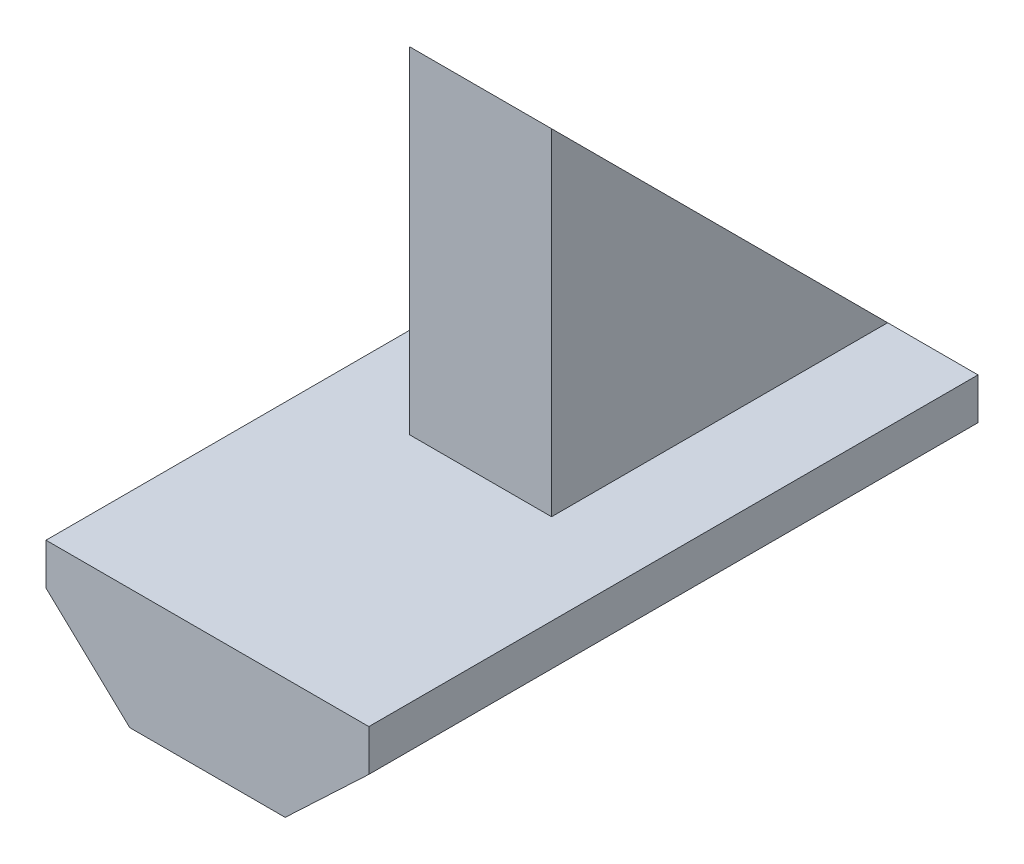
from build123d import *

# Parameters (mm, degrees)
BOSS_EXTRUDE1_DEPTH = 30
BOSS_EXTRUDE2_DEPTH = 3.5


with BuildPart() as part:
    # Sketch1 → Boss-Extrude1 (new body)
    with BuildSketch(Plane.XY):
        Polygon((7.95, 0), (7.95, -2.04), (3.828346154, -5.933696133), (-3.828346154, -5.933696133), (-7.95, -2.04), (-7.95, 0), align=None)
    extrude(amount=BOSS_EXTRUDE1_DEPTH)

    # Sketch2 → Boss-Extrude2 (add, symmetric)
    with BuildSketch(Plane.ZY):
        Polygon((0, 0), (16.551604509, 16.551604509), (16.551604509, 0), align=None)
    extrude(amount=BOSS_EXTRUDE2_DEPTH, both=True)


solid = part.part
